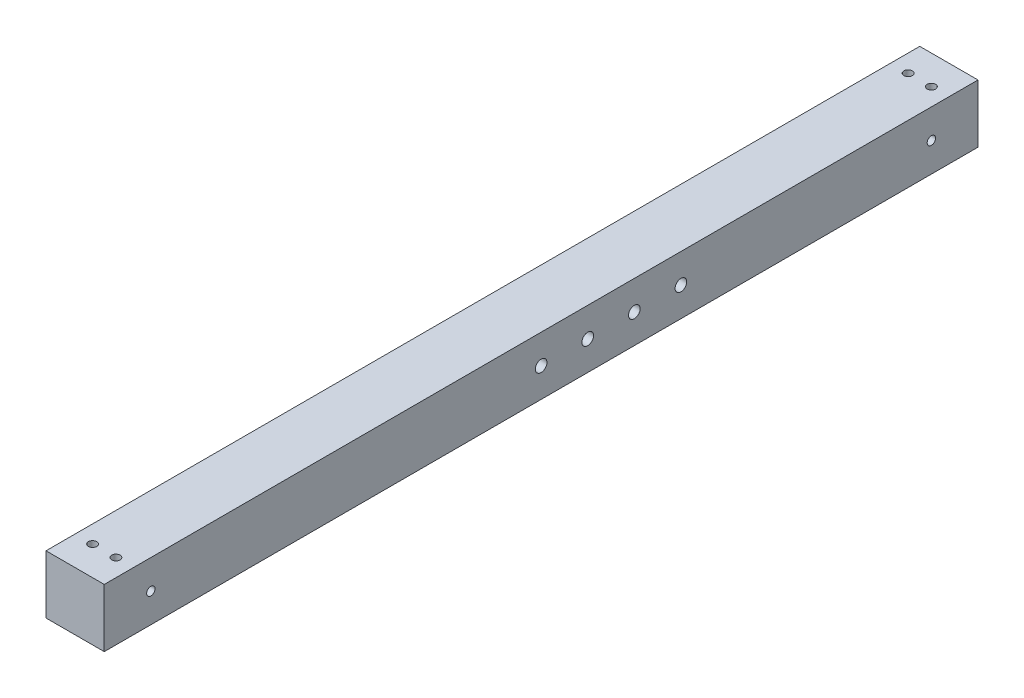
from build123d import *

# Parameters (mm, degrees)
SKETCH1_W               = 25
SKETCH1_H               = 25
BOSS_EXTRUDE1_DEPTH     = 200
SKETCH2_R               = 2.5
CUT_EXTRUDE1_DEPTH      = 202.943680268
SKETCH3_R               = 1.8
CUT_EXTRUDE2_DEPTH      = 202.943680268
SKETCH4_R               = 1.8
CUT_EXTRUDE3_DEPTH      = 202.943680268
CUT_EXTRUDE5_DEPTH      = 202.943680268
CUT_EXTRUDE5_DEPTH_BACK = 202.943680268
SKETCH6_R               = 2.5


with BuildPart() as part:
    # Sketch1 → Boss-Extrude1 (new body)
    with BuildSketch(Plane.XY):
        Rectangle(SKETCH1_W, SKETCH1_H)
    boss_extrude1 = extrude(amount=BOSS_EXTRUDE1_DEPTH)

    # Sketch2 → Cut-Extrude1 (cut, through all)
    with BuildSketch(Plane(origin=(12.5, 0, 0), x_dir=(0, 0, -1), z_dir=(1, 0, 0))):
        with Locations((-12.5, 0)):
            Circle(SKETCH2_R)
    cut_extrude1 = extrude(amount=-CUT_EXTRUDE1_DEPTH, mode=Mode.SUBTRACT)

    # Sketch3 → Cut-Extrude2 (cut, through all)
    with BuildSketch(Plane(origin=(0, 12.5, 0), x_dir=(1, 0, 0), z_dir=(0, 1, 0))):
        with Locations((-5, -187.5)):
            Circle(SKETCH3_R)
        with Locations((5, -187.5)):
            Circle(SKETCH3_R)
    cut_extrude2 = extrude(amount=-CUT_EXTRUDE2_DEPTH, mode=Mode.SUBTRACT)

    # Sketch4 → Cut-Extrude3 (cut, symmetric)
    with BuildSketch(Plane.ZY.offset(12.5)):
        with Locations((180, 0)):
            Circle(SKETCH4_R)
    cut_extrude3 = extrude(amount=CUT_EXTRUDE3_DEPTH, both=True, mode=Mode.SUBTRACT)

    # Mirror2: Boss-Extrude1, Cut-Extrude1, Cut-Extrude2, Cut-Extrude3 across plane
    add(boss_extrude1.mirror(Plane(origin=(0, 0, 12.5), x_dir=(1, 0, 0), z_dir=(0, 0, -1))))
    add(cut_extrude1.mirror(Plane(origin=(0, 0, 12.5), x_dir=(1, 0, 0), z_dir=(0, 0, -1))), mode=Mode.SUBTRACT)
    add(cut_extrude2.mirror(Plane(origin=(0, 0, 12.5), x_dir=(1, 0, 0), z_dir=(0, 0, -1))), mode=Mode.SUBTRACT)
    add(cut_extrude3.mirror(Plane(origin=(0, 0, 12.5), x_dir=(1, 0, 0), z_dir=(0, 0, -1))), mode=Mode.SUBTRACT)

    # Sketch6 → Cut-Extrude5 (cut, two sides: drawn at the far end of the back side and taken through both)
    with BuildSketch(Plane(origin=(12.5, 0, 0), x_dir=(0, 0, -1), z_dir=(1, 0, 0)).offset(-CUT_EXTRUDE5_DEPTH_BACK)):
        with Locations((7.5, 0)):
            Circle(SKETCH6_R)
        with Locations((-12.5, 0)):
            Circle(SKETCH6_R)
        with Locations((27.5, 0)):
            Circle(SKETCH6_R)
        with Locations((47.5, 0)):
            Circle(SKETCH6_R)
    extrude(amount=CUT_EXTRUDE5_DEPTH + CUT_EXTRUDE5_DEPTH_BACK, mode=Mode.SUBTRACT)


solid = part.part
